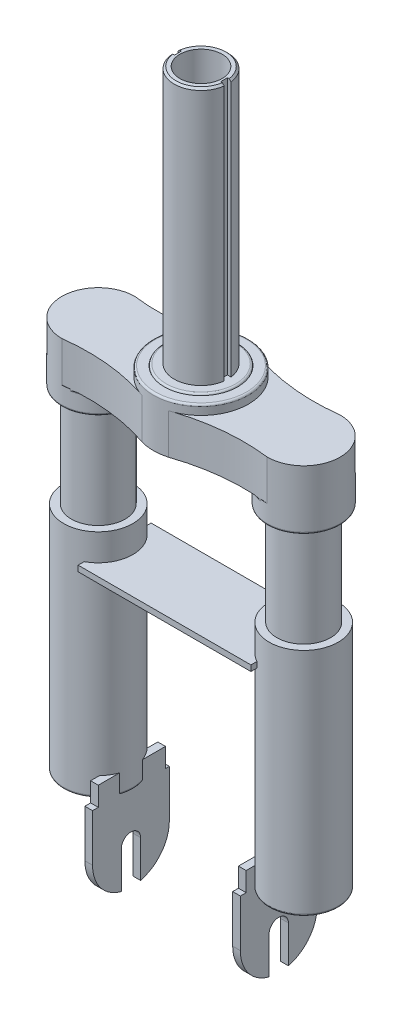
from build123d import *
from build123d.topology import SkipClean

# Parameters (mm, degrees)
SKETCH2_R            = 14
SKETCH2_R_2          = 11
BOSS_EXTRUDE1_DEPTH  = 140
SKETCH3_R            = 17.2
BOSS_EXTRUDE4_DEPTH  = 21
SKETCH7_R            = 24.75
BOSS_EXTRUDE5_DEPTH  = 5
FILLET3_R            = 1
BOSS_EXTRUDE6_START  = 0.9
SKETCH8_R            = 19.15
SKETCH8_R_2          = 14
BOSS_EXTRUDE6_DEPTH  = 0.9
FILLET4_R            = 1
SKETCH9_R            = 19
BOSS_EXTRUDE7_DEPTH  = 10
FILLET5_R            = 1
CHAMFER1_SIZE        = 1
SKETCH10_R           = 14
BOSS_EXTRUDE8_DEPTH  = 53
FILLET7_R            = 1
SKETCH11_R           = 18
BOSS_EXTRUDE9_DEPTH  = 120
FILLET8_R            = 1
BOSS_EXTRUDE14_DEPTH = 4
SKETCH20_W           = 90
SKETCH20_H           = 3
BOSS_EXTRUDE15_DEPTH = 19
CUT_EXTRUDE1_DEPTH   = 2


with BuildPart() as part:
    # Sketch2 → Boss-Extrude1 (new body)
    with BuildSketch(Plane(origin=(0, 0, 0), x_dir=(1, 0, 0), z_dir=(0, 1, 0))):
        with Locations(Location((0, 0, 0), (0, 0, 270))):
            Circle(SKETCH2_R)
        with Locations(Location((0, 0, 0), (0, 0, 270))):
            Circle(SKETCH2_R_2, mode=Mode.SUBTRACT)
    extrude(amount=-BOSS_EXTRUDE1_DEPTH)



with BuildPart() as body_2:
    # Sketch3 → Boss-Extrude4 (new body)
    with BuildSketch(Plane.XZ.offset(140)):
        with BuildLine():
            ThreePointArc((8.728222475, -23.159892755), (28.862466012, -18.820678576), (49.457396096, -18.564949601))
            ThreePointArc((49.457396096, -18.564949601), (51.480840164, -18.762569688), (53.5, -19))
            ThreePointArc((53.5, -19), (72.5, 0), (53.5, 19))
            ThreePointArc((53.5, 19), (51.480840164, 18.762569688), (49.457396096, 18.564949601))
            ThreePointArc((49.457396096, 18.564949601), (28.862466012, 18.820678576), (8.728222475, 23.159892755))
            ThreePointArc((8.728222475, 23.159892755), (7.81378272, 23.459739176), (6.902177911, 23.768097107))
            ThreePointArc((6.902177911, 23.768097107), (0, 24.75), (-6.902177911, 23.768097107))
            ThreePointArc((-6.902177911, 23.768097107), (-7.81378272, 23.459739176), (-8.728222475, 23.159892755))
            ThreePointArc((-8.728222475, 23.159892755), (-28.862466012, 18.820678576), (-49.457396096, 18.564949601))
            ThreePointArc((-49.457396096, 18.564949601), (-51.480840164, 18.762569688), (-53.5, 19))
            ThreePointArc((-53.5, 19), (-72.5, 0), (-53.5, -19))
            ThreePointArc((-53.5, -19), (-51.480840164, -18.762569688), (-49.457396096, -18.564949601))
            ThreePointArc((-49.457396096, -18.564949601), (-28.862466012, -18.820678576), (-8.728222475, -23.159892755))
            ThreePointArc((-8.728222475, -23.159892755), (-7.81378272, -23.459739176), (-6.902177911, -23.768097107))
            ThreePointArc((-6.902177911, -23.768097107), (0, -24.75), (6.902177911, -23.768097107))
            ThreePointArc((6.902177911, -23.768097107), (7.81378272, -23.459739176), (8.728222475, -23.159892755))
        make_face()
        with Locations(Location((0, 0, 0), (0, 0, 90))):
            Circle(SKETCH3_R, mode=Mode.SUBTRACT)
    extrude(amount=BOSS_EXTRUDE4_DEPTH)


with BuildPart() as part_1:
    with SkipClean():  # the faces are left unmerged after this step: merging them gives an invalid solid
        add(part.part)

        add(body_2.part)  # Boss-Extrude5 merges body 2
        # Sketch7 → Boss-Extrude5 (add)
        with BuildSketch(Plane(origin=(0, -140, 0), x_dir=(1, 0, 0), z_dir=(0, 1, 0))):
            with Locations(Location((0, 0, 0), (0, 0, 73.806875111))):
                Circle(SKETCH7_R)
        extrude(amount=BOSS_EXTRUDE5_DEPTH)

    # Fillet3
    fillet3_edges = [part_1.edges().sort_by_distance(p)[0] for p in [
        (-6.902177911, -135, 23.768097107),
    ]]
    fillet(fillet3_edges, radius=FILLET3_R)

    # Sketch8 → Boss-Extrude6 (add)
    with SkipClean():  # the faces are left unmerged after this step: merging them gives an invalid solid
        with BuildSketch(Plane(origin=(0, -135, 0), x_dir=(1, 0, 0), z_dir=(0, 1, 0)).offset(BOSS_EXTRUDE6_START)):
            with Locations(Location((0, 0, 0), (0, 0, 270))):
                Circle(SKETCH8_R)
            with Locations(Location((0, 0, 0), (0, 0, 270))):
                Circle(SKETCH8_R_2, mode=Mode.SUBTRACT)
        extrude(amount=-BOSS_EXTRUDE6_DEPTH)

    # Fillet4
    # the kernel refuses this fillet: 1 mm, written as the material it takes off along each edge
    with BuildSketch(Plane(origin=(0, -134.1, 0), x_dir=(0, 0, 1), z_dir=(-1, 0, 0))) as fillet4_piece_1:
        with BuildLine():
            CenterArc((18.155012563, -1), FILLET4_R, 5.739170477, 84.260829523)
            Line((18.155012563, 0), (18.155012563, 0.02))
            Line((18.155012563, 0.02), (19.15, 0.02))
            Line((19.15, 0.02), (19.17, 0))
            ThreePointArc((19.17, 0), (19.17, -0.45), (19.169899749, -0.898))
            Line((19.169899749, -0.898), (19.15, -0.9))
        make_face()
    revolve(axis=Axis((0, -134.1, 0), (0, 1, 0)), mode=Mode.SUBTRACT)

    # Sketch9 → Boss-Extrude7 (add)
    with SkipClean():  # the faces are left unmerged after this step: merging them gives an invalid solid
        with BuildSketch(Plane.XZ.offset(161)):
            with Locations(Location((-53.5, 0, 0), (0, 0, 270))):
                Circle(SKETCH9_R)
            with Locations(Location((53.5, 0, 0), (0, 0, 90))):
                Circle(SKETCH9_R)
        extrude(amount=BOSS_EXTRUDE7_DEPTH)

    # Fillet5
    # the kernel refuses this fillet: 1 mm, written as the material it adds along each edge
    with BuildSketch(Plane(origin=(-53.5, -161, 0), x_dir=(0.08257677749843437, 0, -0.9965847057917225), z_dir=(-0.9965847057917225, 0, -0.08257677749843437))) as fillet5_piece_1_section:
        with BuildLine():
            CenterArc((19 + FILLET5_R, FILLET5_R), FILLET5_R, 180, 90)
            Line((19, FILLET5_R), (19, 0))
            Line((19, 0), (19 + FILLET5_R, 0))
        make_face()
    fillet5_piece_1 = revolve(axis=Axis((-53.5, -161, 0), (0, -1, 0)), revolution_arc=170.526611066, mode=Mode.PRIVATE)
    fillet5_piece_1 = fillet5_piece_1 - Plane(origin=(-40.435266864, -161.27732676, -121.400971601), x_dir=(-0.12655819396211102, 0, 0.9919591844128712), z_dir=(0, 1, 0)) * Cylinder(103.231033302, 81, mode=Mode.PRIVATE)
    fillet5_piece_1 = fillet5_piece_1 - Plane(origin=(-40.435266864, -161.27732676, 121.400971601), x_dir=(0.32483535115732903, 0, -0.9457705824556476), z_dir=(0, 1, 0)) * Cylinder(103.231033302, 81, mode=Mode.PRIVATE)
    add(fillet5_piece_1)
    with BuildSketch(Plane(origin=(53.5, -161, 0), x_dir=(-0.08257677751286734, 0, 0.9965847057905265), z_dir=(0.9965847057905265, 0, 0.08257677751286734))) as fillet5_piece_2_section:
        with BuildLine():
            CenterArc((19 + FILLET5_R, FILLET5_R), FILLET5_R, 180, 90)
            Line((19, FILLET5_R), (19, 0))
            Line((19, 0), (19 + FILLET5_R, 0))
        make_face()
    fillet5_piece_2 = revolve(axis=Axis((53.5, -161, 0), (0, -1, 0)), revolution_arc=170.526611065, mode=Mode.PRIVATE)
    fillet5_piece_2 = fillet5_piece_2 - Plane(origin=(40.435266865, -161.27732676, -121.400971601), x_dir=(-0.3248353511573105, 0, 0.9457705824556539), z_dir=(0, 1, 0)) * Cylinder(103.231033303, 81, mode=Mode.PRIVATE)
    fillet5_piece_2 = fillet5_piece_2 - Plane(origin=(40.435266864, -161.27732676, 121.400971601), x_dir=(0.1265581939621054, 0, -0.991959184412872), z_dir=(0, 1, 0)) * Cylinder(103.231033302, 81, mode=Mode.PRIVATE)
    add(fillet5_piece_2)
    # the kernel refuses this fillet: 1 mm, written as the material it takes off along each edge
    with BuildSketch(Plane(origin=(-53.5, -171, 0), x_dir=(0, 0, -1), z_dir=(-1, 0, 0))) as fillet5_2_piece_1:
        with BuildLine():
            CenterArc((19 - FILLET5_R, -FILLET5_R), FILLET5_R, 0, 90)
            Line((19 - FILLET5_R, 0), (19, 0))
            Line((19, 0), (19, -FILLET5_R))
        make_face()
    revolve(axis=Axis((-53.5, -171, 0), (0, -1, 0)), mode=Mode.SUBTRACT)
    with BuildSketch(Plane(origin=(53.5, -171, 0), x_dir=(0, 0, 1), z_dir=(1, 0, 0))) as fillet5_2_piece_2:
        with BuildLine():
            CenterArc((19 - FILLET5_R, -FILLET5_R), FILLET5_R, 0, 90)
            Line((19 - FILLET5_R, 0), (19, 0))
            Line((19, 0), (19, -FILLET5_R))
        make_face()
    revolve(axis=Axis((53.5, -171, 0), (0, -1, 0)), mode=Mode.SUBTRACT)

    # Chamfer1
    chamfer1_edges = [part_1.edges().sort_by_distance(p)[0] for p in [
        (0, 0, -14),
    ]]
    chamfer(chamfer1_edges, length=CHAMFER1_SIZE)

    # Sketch10 → Boss-Extrude8 (add)
    with SkipClean():  # the faces are left unmerged after this step: merging them gives an invalid solid
        with BuildSketch(Plane.XZ.offset(171)):
            with Locations(Location((-53.5, 0, 0), (0, 0, 270))):
                Circle(SKETCH10_R)
            with Locations(Location((53.5, 0, 0), (0, 0, 90))):
                Circle(SKETCH10_R)
        extrude(amount=BOSS_EXTRUDE8_DEPTH)

    # Fillet7
    fillet7_edges = [part_1.edges().sort_by_distance(p)[0] for p in [
        (-53.5, -171, 14),
        (53.5, -171, -14),
    ]]
    fillet(fillet7_edges, radius=FILLET7_R)

    # Sketch11 → Boss-Extrude9 (add)
    with SkipClean():  # the faces are left unmerged after this step: merging them gives an invalid solid
        with BuildSketch(Plane.XZ.offset(224)):
            with Locations(Location((-53.5, 0, 0), (0, 0, 270))):
                Circle(SKETCH11_R)
            with Locations(Location((53.5, 0, 0), (0, 0, 90))):
                Circle(SKETCH11_R)
        extrude(amount=BOSS_EXTRUDE9_DEPTH)

    # Fillet8
    fillet8_edges = [part_1.edges().sort_by_distance(p)[0] for p in [
        (-53.5, -344, 18),
        (53.5, -344, -18),
    ]]
    fillet(fillet8_edges, radius=FILLET8_R)

    # Sketch13 → Boss-Extrude14 (add)
    with SkipClean():  # the faces are left unmerged after this step: merging them gives an invalid solid
        with BuildSketch(Plane(origin=(36.5, 0, 0), x_dir=(0, 0, -1), z_dir=(1, 0, 0))):
            with BuildLine():
                Line((-17, -334), (18, -334))
                Line((18, -334), (18, -344))
                Line((18, -344), (20, -344))
                Line((20, -344), (20, -368.63383608))
                ThreePointArc((20, -368.63383608), (15.817711592, -380.873117105), (5.02, -387.993577814))
                Line((5.02, -387.993577814), (5.02, -368.63383608))
                ThreePointArc((5.02, -368.63383608), (0, -363.61383608), (-5.02, -368.63383608))
                Line((-5.02, -368.63383608), (-5.02, -387.993577814))
                ThreePointArc((-5.02, -387.993577814), (-15.817711592, -380.873117105), (-20, -368.63383608))
                Line((-20, -368.63383608), (-20, -344))
                Line((-20, -344), (-17, -344))
                Line((-17, -344), (-17, -334))
            make_face()
        boss_extrude14 = extrude(amount=BOSS_EXTRUDE14_DEPTH)

    # Mirror4: Boss-Extrude14 across plane
    with SkipClean():  # the faces are left unmerged after this step: merging them gives an invalid solid
        add(boss_extrude14.mirror(Plane(origin=(0, 0, 0), x_dir=(0, 0, 1), z_dir=(1, 0, 0))))

    # Sketch20 → Boss-Extrude15 (add, symmetric)
    with SkipClean():  # the faces are left unmerged after this step: merging them gives an invalid solid
        with BuildSketch(Plane.XY):
            with Locations((0, -239.493577814)):
                Rectangle(SKETCH20_W, SKETCH20_H)
        extrude(amount=BOSS_EXTRUDE15_DEPTH, both=True)

    # Sketch21 → Cut-Extrude1 (cut)
    with SkipClean():  # the faces are left unmerged after this step: merging them gives an invalid solid
        with BuildSketch(Plane(origin=(14, 0, 0), x_dir=(0, 0, -1), z_dir=(1, 0, 0))):
            Polygon((-1.78467608, -134.1), (1.78467608, -134.1), (1.78467608, -1), (1.78467608, 0), (-1.78467608, 0), align=None)
        cut_extrude1 = extrude(amount=-CUT_EXTRUDE1_DEPTH, mode=Mode.SUBTRACT)

    # Mirror5: Cut-Extrude1 across plane
    with SkipClean():  # the faces are left unmerged after this step: merging them gives an invalid solid
        add(cut_extrude1.mirror(Plane(origin=(0, 0, 0), x_dir=(0, 0, 1), z_dir=(1, 0, 0))), mode=Mode.SUBTRACT)


solid = part_1.part
